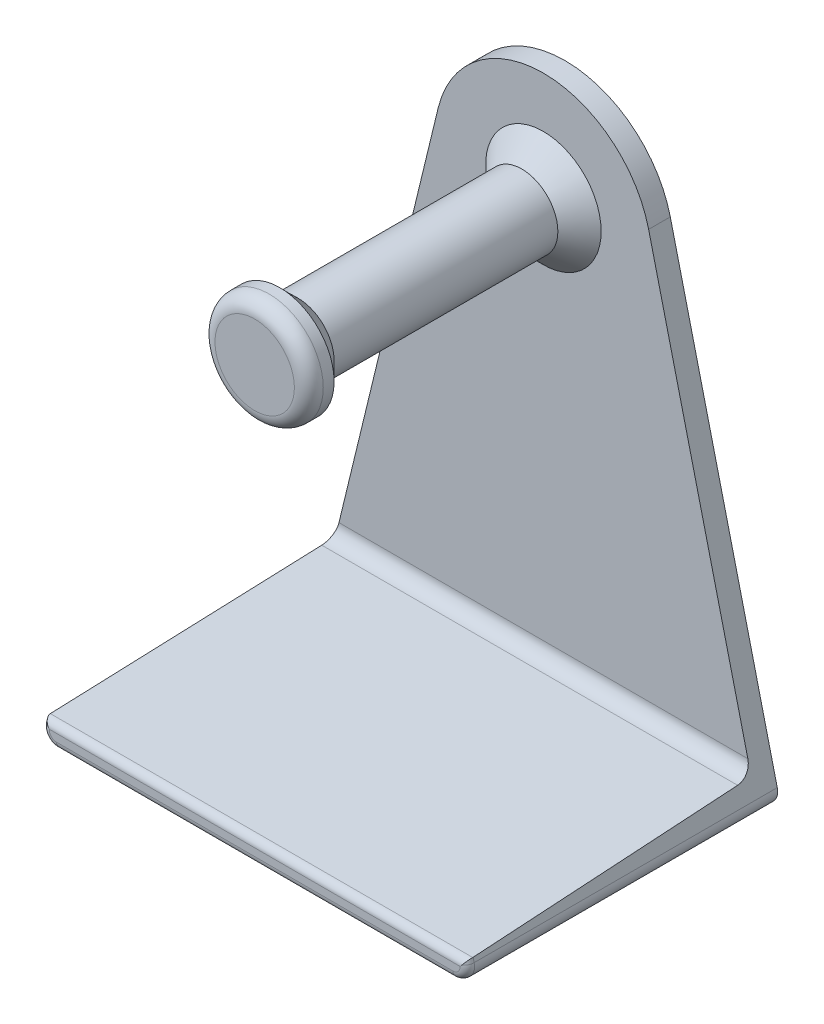
from build123d import *

# Parameters (mm, degrees)
EXTRUDE_1_DEPTH      = 3
SKETCH_2_R           = 5
EXTRUDE_2_DEPTH      = 40
SKETCH_3_R           = 7.5
EXTRUDE_3_DEPTH      = 3
CHAMFER_1_SIZE       = 3
EXTRUDE_4_DEPTH      = 40
EXTRUDE_5_DEPTH      = 30
EXTRUDE_5_DEPTH_BACK = 30
SKETCH_1_2_OUTSIDE_W = 83.046
SKETCH_1_2_OUTSIDE_H = 98.046
CUT_EXTRUDE_1_DEPTH  = 80.680612447
FILLET_1_R           = 2
FILLET_2_R           = 1
FILLET_3_R           = 2


with BuildPart() as part:
    # 草图1 → 凸台-拉伸1 (new body)
    with BuildSketch(Plane.XY):
        with BuildLine():
            Line((-14.576696831, 3.538348415), (-29.4, -57.528220211))
            ThreePointArc((-29.4, -57.528220211), (-29.028629911, -59.236212041), (-27.456440423, -60))
            Line((-27.456440423, -60), (27.456440423, -60))
            ThreePointArc((27.456440423, -60), (29.028629911, -59.236212041), (29.4, -57.528220211))
            Line((29.4, -57.528220211), (14.576696831, 3.538348415))
            ThreePointArc((14.576696831, 3.538348415), (0, 15), (-14.576696831, 3.538348415))
        make_face()
    extrude(amount=EXTRUDE_1_DEPTH)

    # 草图2 → 凸台-拉伸2 (add)
    with BuildSketch(Plane.XY.offset(3)):
        Circle(SKETCH_2_R)
    extrude(amount=EXTRUDE_2_DEPTH)

    # 草图3 → 凸台-拉伸3 (add)
    with BuildSketch(Plane.XY.offset(43)):
        Circle(SKETCH_3_R)
    extrude(amount=-EXTRUDE_3_DEPTH)

    # 倒角1
    # the kernel refuses this chamfer: 3 mm, written as the material it adds along each edge
    with BuildSketch(Plane(origin=(0, 0, 40), x_dir=(1, 0, 0), z_dir=(0, 1, 0))) as chamfer_1_piece_1_section:
        Polygon((5, CHAMFER_1_SIZE), (5 + CHAMFER_1_SIZE, 0), (5, 0), align=None)
    chamfer_1_piece_1 = revolve(axis=Axis((0, 0, 40), (0, 0, -1)), mode=Mode.PRIVATE)
    chamfer_1_piece_1 = chamfer_1_piece_1 & Plane(origin=(0, 0, 38.247274928), x_dir=(1, 0, 0), z_dir=(0, 0, 1)) * Cylinder(7.5, 32, mode=Mode.PRIVATE)
    add(chamfer_1_piece_1)
    with BuildSketch(Plane(origin=(0, 0, 3), x_dir=(1, 0, 0), z_dir=(0, -1, 0))) as chamfer_1_piece_2:
        Polygon((5 + CHAMFER_1_SIZE, 0), (5, CHAMFER_1_SIZE), (5, 0), align=None)
    revolve(axis=Axis((0, 0, 3), (0, 0, 1)))

    # 草图4 → 凸台-拉伸4 (add)
    with BuildSketch(Plane.XY.offset(3)):
        with BuildLine():
            Line((-29.271779789, -57), (29.271779789, -57))
            Line((29.271779789, -57), (29.4, -57.528220211))
            ThreePointArc((29.4, -57.528220211), (29.028629911, -59.236212041), (27.456440423, -60))
            Line((27.456440423, -60), (-27.456440423, -60))
            ThreePointArc((-27.456440423, -60), (-29.028629911, -59.236212041), (-29.4, -57.528220211))
            Line((-29.4, -57.528220211), (-29.271779789, -57))
        make_face()
    extrude(amount=EXTRUDE_4_DEPTH)

    # 草图6 → 凸台-拉伸5 (add, two sides: drawn at the far end of the back side and taken through both)
    with BuildSketch(Plane(origin=(0, 0, 0), x_dir=(0, 0, -1), z_dir=(1, 0, 0)).offset(-EXTRUDE_5_DEPTH_BACK)):
        Polygon((-43, -57), (-3, -55), (-3, -57), align=None)
    extrude(amount=EXTRUDE_5_DEPTH + EXTRUDE_5_DEPTH_BACK)

    # 草图1<2> outside → 切除-拉伸1 (cut, through all)
    with BuildSketch(Plane.XY):
        with Locations((0, -22.5)):
            Rectangle(SKETCH_1_2_OUTSIDE_W, SKETCH_1_2_OUTSIDE_H)
        with BuildLine():
            Line((-14.576696831, 3.538348415), (-29.4, -57.528220211))
            ThreePointArc((-29.4, -57.528220211), (-29.028629911, -59.236212041), (-27.456440423, -60))
            Line((-27.456440423, -60), (27.456440423, -60))
            ThreePointArc((27.456440423, -60), (29.028629911, -59.236212041), (29.4, -57.528220211))
            Line((29.4, -57.528220211), (14.576696831, 3.538348415))
            ThreePointArc((14.576696831, 3.538348415), (0, 15), (-14.576696831, 3.538348415))
        make_face(mode=Mode.SUBTRACT)
    extrude(amount=CUT_EXTRUDE_1_DEPTH, mode=Mode.SUBTRACT)

    # 圆角1
    fillet_1_edges = [part.edges().sort_by_distance(p)[0] for p in [
        (0, -55, 3),
    ]]
    fillet(fillet_1_edges, radius=FILLET_1_R)

    # 圆角2
    # the kernel refuses this fillet: 1 mm, written as the material it takes off along each edge
    with BuildSketch(Plane(origin=(27.456440423, -58, 43), x_dir=(0.971779788708135, 0.23588989435406618, 0), z_dir=(-0.23588989435406618, 0.971779788708135, 0))) as fillet_2_piece_1:
        with BuildLine():
            CenterArc((2 - FILLET_2_R, FILLET_2_R), FILLET_2_R, 270, 90)
            Line((2, FILLET_2_R), (2, 0))
            Line((2, 0), (2 - FILLET_2_R, 0))
        make_face()
    revolve(axis=Axis((27.456440423, -58, 43), (0, 0, -1)), revolution_arc=103.644084795, mode=Mode.SUBTRACT)
    with BuildSketch(Plane(origin=(27.456440423, -60, 43), x_dir=(0, 1, 0), z_dir=(-1, 0, 0))) as fillet_2_piece_2:
        with BuildLine():
            CenterArc((FILLET_2_R, FILLET_2_R), FILLET_2_R, 180, 90)
            Line((0, FILLET_2_R), (0, 0))
            Line((0, 0), (FILLET_2_R, 0))
        make_face()
    extrude(amount=54.912880845, mode=Mode.SUBTRACT)
    with BuildSketch(Plane(origin=(-27.456440423, -58, 43), x_dir=(0, -1, 0), z_dir=(1, 0, 0))) as fillet_2_piece_3:
        with BuildLine():
            CenterArc((2 - FILLET_2_R, FILLET_2_R), FILLET_2_R, 270, 90)
            Line((2, FILLET_2_R), (2, 0))
            Line((2, 0), (2 - FILLET_2_R, 0))
        make_face()
    revolve(axis=Axis((-27.456440423, -58, 43), (0, 0, -1)), revolution_arc=103.644084795, mode=Mode.SUBTRACT)
    with BuildSketch(Plane(origin=(-31.649902838, -57, 43), x_dir=(0, 0.049937616943894474, -0.9987523388778445), z_dir=(1, 0, 0))) as fillet_2_piece_4:
        with BuildLine():
            CenterArc((FILLET_2_R * 0.951249219725, -FILLET_2_R), FILLET_2_R, 90, 87.137594774)
            Line((-FILLET_2_R * 0.0475031191528, -FILLET_2_R * 0.950062383056), (0, 0))
            Line((0, 0), (FILLET_2_R * 0.951249219725, 0))
        make_face()
    extrude(amount=63.299805676, mode=Mode.SUBTRACT)
    with BuildSketch(Plane(origin=(-29.4, -57.528220211, 43), x_dir=(0, 0, -1), z_dir=(0.23588989435405947, 0.9717797887081366, 0)), Plane(origin=(28.682055053, -54.570550528, 43), x_dir=(0, 0, -1), z_dir=(0.2358898943540625, -0.971779788708136, 0))) as fillet_2_piece_5:
        with BuildLine():
            CenterArc((FILLET_2_R, -FILLET_2_R), FILLET_2_R, 90, 90)
            Line((0, -FILLET_2_R), (0, 0))
            Line((0, 0), (FILLET_2_R, 0))
        make_face()
    extrude(amount=3.043559577, mode=Mode.SUBTRACT)

    # 圆角3
    fillet_3_edges = [part.edges().sort_by_distance(p)[0] for p in [
        (-7.5, 0, 43),
    ]]
    fillet(fillet_3_edges, radius=FILLET_3_R)


solid = part.part
